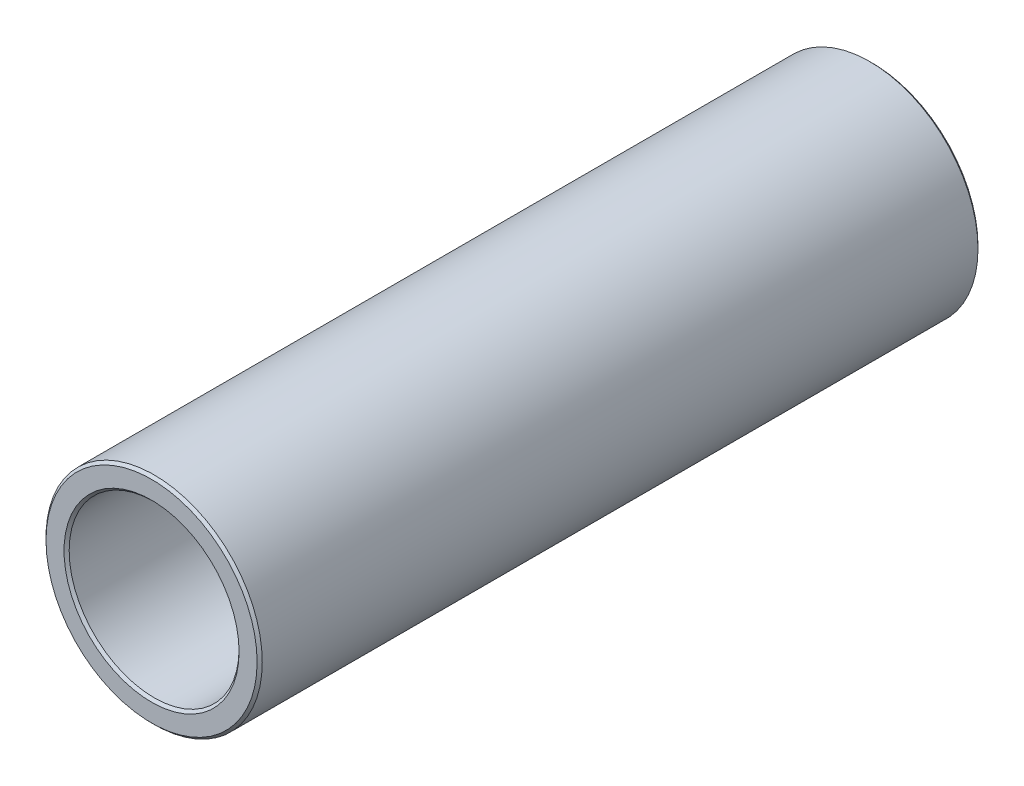
from build123d import *

# Parameters (mm, degrees)
SZKIC1_W = 140
SZKIC1_H = 21


with BuildPart() as part:
    # Szkic1 → Obrót1 (revolve)
    with BuildSketch(Plane(origin=(0, 0, 0), x_dir=(0, 0, -1), z_dir=(1, 0, 0))):
        with Locations((-70, 10.5)):
            Rectangle(SZKIC1_W, SZKIC1_H)
    revolve(axis=Axis((0, 0, 0), (0, 0, 1)))

    # Szkic2 → Wycięcie-obrót1 (revolve, cut)
    with BuildSketch(Plane(origin=(0, 0, 0), x_dir=(0, 0, -1), z_dir=(1, 0, 0))):
        Polygon((-140, 20.5), (-139.5, 21), (-140, 21), align=None)
    revolve(axis=Axis((0, 0, 0), (0, 0, 1)), mode=Mode.SUBTRACT)

    # Szkic3 → Wycięcie-obrót2 (revolve, cut)
    with BuildSketch(Plane(origin=(0, 0, 0), x_dir=(0, 0, -1), z_dir=(1, 0, 0))):
        Polygon((-0.5, 21), (0, 20.5), (0, 21), align=None)
    revolve(axis=Axis((0, 0, 0), (0, 0, 1)), mode=Mode.SUBTRACT)

    # Szkic4 → Wycięcie-obrót3 (revolve, cut)
    with BuildSketch(Plane(origin=(0, 0, 0), x_dir=(0, 0, -1), z_dir=(1, 0, 0))):
        Polygon((-13, 0), (-13, 16.5), (-11.9175, 6.9175), (-1.0825, 6.9175), (0, 8), (0, 0), align=None)
    revolve(axis=Axis((0, 0, 0), (0, 0, 1)), mode=Mode.SUBTRACT)

    # Szkic5 → Wycięcie-obrót4 (revolve, cut)
    with BuildSketch(Plane(origin=(0, 0, 0), x_dir=(0, 0, -1), z_dir=(1, 0, 0))):
        Polygon((-140, 0), (-140, 17), (-139.5, 16.5), (-13, 16.5), (-13, 0), align=None)
    revolve(axis=Axis((0, 0, 13), (0, 0, 1)), mode=Mode.SUBTRACT)


solid = part.part
